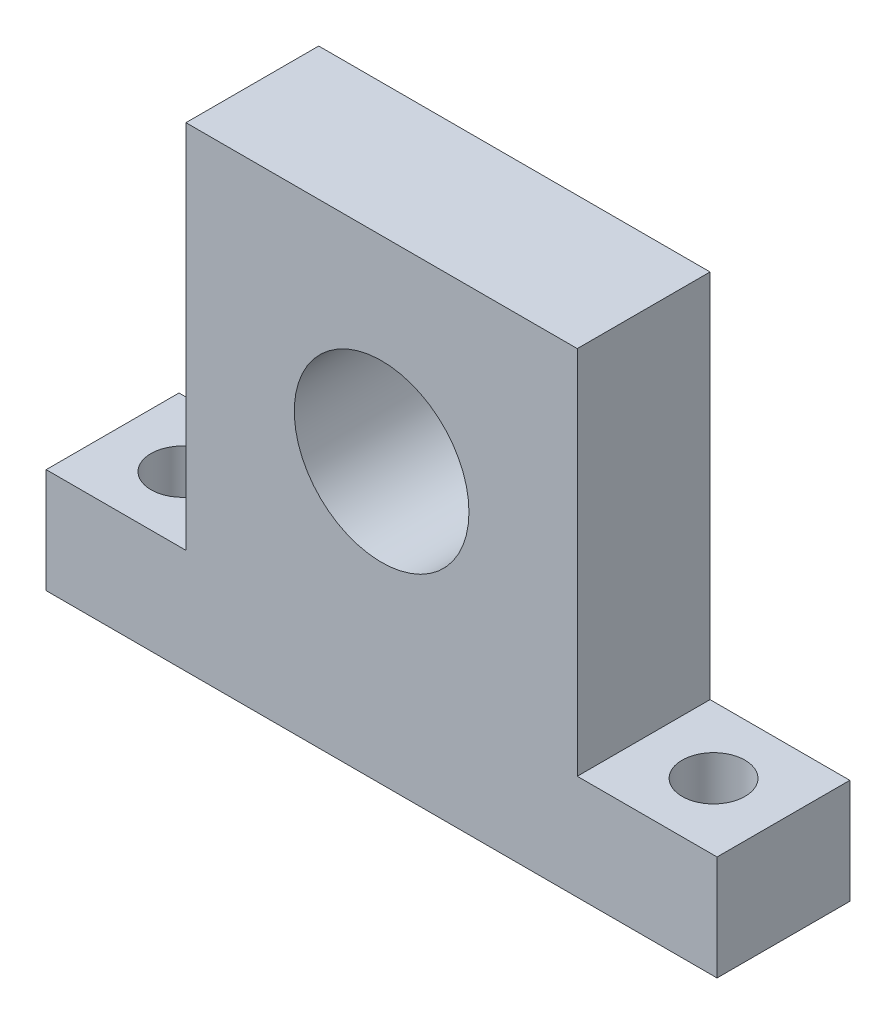
from build123d import *

# Parameters (mm, degrees)
SKETCH_1_R          = 12.5
EXTRUDE_1_DEPTH     = 19
SKETCH_2_R          = 4.5
CUT_EXTRUDE_1_DEPTH = 74.986485252


with BuildPart() as part:
    # 草图1 → 凸台-拉伸1 (new body)
    with BuildSketch(Plane.XY):
        Polygon((-48, -40), (-48, -25), (-28, -25), (-28, 28), (28, 28), (28, -25), (48, -25), (48, -40), align=None)
        Circle(SKETCH_1_R, mode=Mode.SUBTRACT)
    extrude(amount=EXTRUDE_1_DEPTH)

    # 草图2 → 切除-拉伸1 (cut, through all)
    with BuildSketch(Plane(origin=(0, -25, 0), x_dir=(1, 0, 0), z_dir=(0, 1, 0))):
        with Locations((-38, -9.5)):
            Circle(SKETCH_2_R)
        with Locations((38, -9.5)):
            Circle(SKETCH_2_R)
    extrude(amount=-CUT_EXTRUDE_1_DEPTH, mode=Mode.SUBTRACT)


solid = part.part
